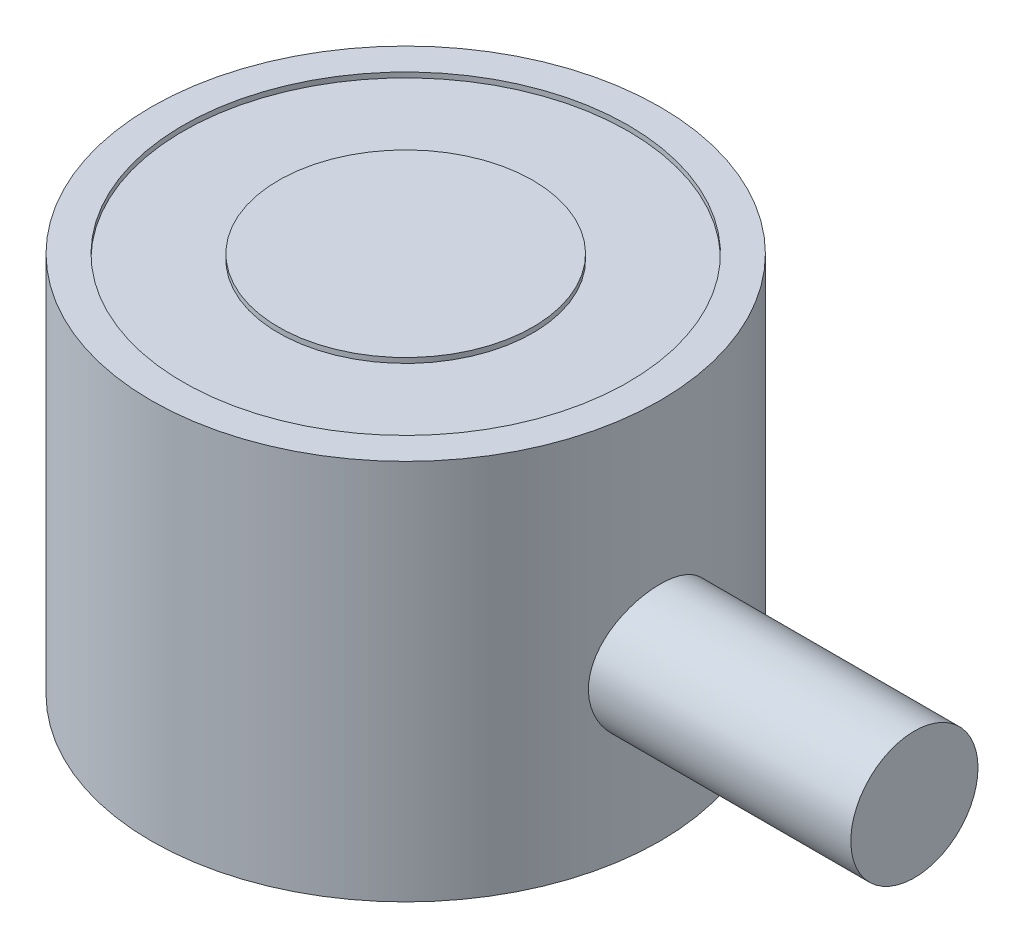
from build123d import *

# Parameters (mm, degrees)
SKETCH1_R                    = 12.7
BOSS_EXTRUDE1_DEPTH          = 19.05
SKETCH2_W                    = 4.7625
SKETCH2_H                    = 0.254
SKETCH3_R                    = 2.413
CUT_EXTRUDE1_DEPTH           = 9.525
SWEEP1_PITCH                 = 0.79375
SKETCH6_R                    = 2.498925958
CUT_EXTRUDE2_OTHER_WAY_DEPTH = 27.18172082
BOSS_EXTRUDE2_START          = 25.4
SKETCH7_R                    = 3.175
BOSS_EXTRUDE2_DEPTH          = 13.103277876


with BuildPart() as part:
    # Sketch1 → Boss-Extrude1 (new body)
    with BuildSketch(Plane(origin=(0, 0, 0), x_dir=(1, 0, 0), z_dir=(0, 1, 0))):
        with Locations(Location((0, 0, 0), (0, 0, 90))):
            Circle(SKETCH1_R)
    extrude(amount=BOSS_EXTRUDE1_DEPTH)

    # Sketch2 → Cut-Revolve1 (revolve, cut)
    with BuildSketch(Plane.XY, mode=Mode.PRIVATE) as cut_revolve1_sk:
        with Locations((-8.73125, 18.923)):
            Rectangle(SKETCH2_W, SKETCH2_H)
    revolve(cut_revolve1_sk.sketch.rotate(Axis((0, 0, 0), (0, 1, 0)), 270), axis=Axis((0, 0, 0), (0, 1, 0)), mode=Mode.SUBTRACT)

    # Sketch3 → Cut-Extrude1 (cut)
    with BuildSketch(Plane.XZ):
        with Locations(Location((0, 0, 0), (0, 0, 270))):
            Circle(SKETCH3_R)
    extrude(amount=-CUT_EXTRUDE1_DEPTH, mode=Mode.SUBTRACT)

    # Sweep1: the profile of Sketch5 screwed along a right-hand helix of 13 turns, 8 arcs to a turn; built about Z, then put on its axis
    sweep1_z = Axis((0, 0, 0), (0, 0, 1))
    sweep1_corners = [(2.455962979, 0, -0.719335938), (2.455962979, 0, 0.024804688), (1.98337021, 0, -0.248046875), (1.98337021, 0, -0.446484375)]
    with BuildLine(mode=Mode.PRIVATE) as sweep1_profile:
        Line(sweep1_corners[0], sweep1_corners[1])
        Line(sweep1_corners[1], sweep1_corners[2])
        Line(sweep1_corners[2], sweep1_corners[3])
        Line(sweep1_corners[3], sweep1_corners[0])
    sweep1_cap = Face(sweep1_profile.wire())
    sweep1_turn_angles = [0, 22.5, 45, 67.5, 90, 112.5, 135, 157.5, 180, 202.5, 225, 247.5, 270, 292.5, 315, 337.5, 360]
    sweep1_turn_weights = [1, 0.9238795325112867, 1, 0.9238795325112867, 1, 0.9238795325112867, 1, 0.9238795325112867, 1, 0.9238795325112867, 1, 0.9238795325112867, 1, 0.9238795325112867, 1, 0.9238795325112867, 1]
    sweep1_turn_rails = [Edge.make_bspline([Vector(p[0], p[1], 0).rotate(sweep1_z, sweep1_turn_angles[k]) / sweep1_turn_weights[k] + Vector(0, 0, p[2] + SWEEP1_PITCH * sweep1_turn_angles[k] / 360) for k in range(17)], [0, 0, 0, 1, 1, 2, 2, 3, 3, 4, 4, 5, 5, 6, 6, 7, 7, 8, 8, 8], 2, sweep1_turn_weights) for p in sweep1_corners]
    sweep1_turn_sides = [Face.make_surface_from_curves(sweep1_turn_rails[p[0]], sweep1_turn_rails[p[1]]) for p in [(0, 1), (1, 2), (2, 3), (3, 0)]]
    sweep1 = Plane(origin=(0, 0, 0), x_dir=(-1, 0, 0), z_dir=(0, 1, 0)) * Solid(Shell([*[p.moved(Location((0, 0, SWEEP1_PITCH * i))) for i in range(13) for p in sweep1_turn_sides], sweep1_cap, sweep1_cap.rotate(sweep1_z, 4680).moved(Location((0, 0, SWEEP1_PITCH * 4680 / 360)))]))
    add(sweep1)

    # Cut-Extrude2 cone 1 section (through the dimple's axis) → Cut-Extrude2 (revolve, cut)
    with BuildSketch(Plane(origin=(0, 0, 0), x_dir=(0, 0, -1), z_dir=(1, 0, 0))):
        Polygon((0, 0), (2.498925958, 0), (0, 2.498925958), align=None)
    revolve(axis=Axis((0, 0, 0), (0, 1, 0)), mode=Mode.SUBTRACT)

    # Sketch6 → Cut-Extrude2 other way (cut)
    with BuildSketch(Plane.XZ):
        Circle(SKETCH6_R)
    extrude(amount=CUT_EXTRUDE2_OTHER_WAY_DEPTH, mode=Mode.SUBTRACT)

    # Sketch7 → Boss-Extrude2 (add)
    with BuildSketch(Plane(origin=(0, 0, 0), x_dir=(0, 0, -1), z_dir=(1, 0, 0)).offset(BOSS_EXTRUDE2_START)):
        with Locations((0, 7.9375)):
            Circle(SKETCH7_R)
    extrude(amount=-BOSS_EXTRUDE2_DEPTH)


solid = part.part
